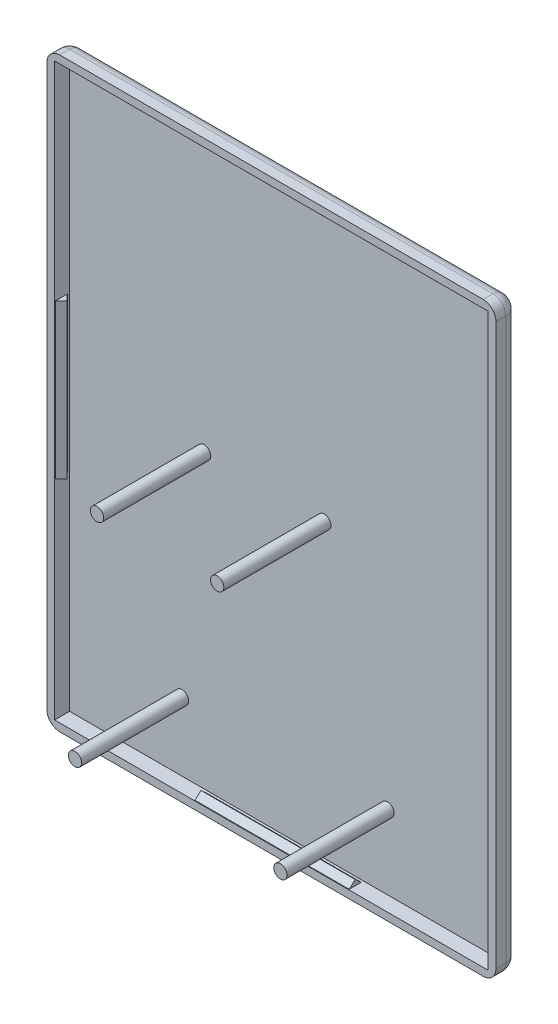
from build123d import *

# Parameters (mm, degrees)
ESQUISSE1_W        = 101.2
ESQUISSE1_H        = 133.2
BOSS_EXTRU_1_DEPTH = 3.5
COQUE1_T           = 1.8
CONG_4_R           = 3
BOSS_EXTRU_2_DEPTH = 18
BOSS_EXTRU_3_DEPTH = 18
ESQUISSE5_R        = 1.55
BOSS_EXTRU_4_DEPTH = 25


with BuildPart() as part:
    # Esquisse1 → Boss.-Extru.1 (new body)
    with BuildSketch(Plane.XY):
        Rectangle(ESQUISSE1_W, ESQUISSE1_H)
    extrude(amount=-BOSS_EXTRU_1_DEPTH)

    # Coque1
    coque1_openings = [part.faces().sort_by_distance(p)[0] for p in [
        (0, 0, 0),
    ]]
    offset(amount=COQUE1_T, openings=coque1_openings, kind=Kind.INTERSECTION)

    # Congé4
    # the kernel refuses this fillet: 3 mm, written as the material it takes off along each edge
    with BuildSketch(Plane(origin=(-49.4, -65.4, -2.3), x_dir=(0, 0, -1), z_dir=(-1, 0, 0))) as cong_4_piece_1_section:
        Polygon((0, 0), (CONG_4_R, 0), (CONG_4_R, CONG_4_R), (0, CONG_4_R), align=None)
    cong_4_piece_1 = extrude(amount=CONG_4_R, mode=Mode.PRIVATE)
    cong_4_piece_1 = cong_4_piece_1 - Plane(origin=(-49.4, -65.4, -2.3), x_dir=(0, 0.7071067811865475, 0.7071067811865475), z_dir=(-1, 0, 0)) * Sphere(CONG_4_R, mode=Mode.PRIVATE)
    add(cong_4_piece_1, mode=Mode.SUBTRACT)
    with BuildSketch(Plane(origin=(-49.4, 65.4, -2.3), x_dir=(-1, 0, 0), z_dir=(0, 1, 0))) as cong_4_piece_2_section:
        Polygon((0, 0), (CONG_4_R, 0), (CONG_4_R, -CONG_4_R), (0, -CONG_4_R), align=None)
    cong_4_piece_2 = extrude(amount=CONG_4_R, mode=Mode.PRIVATE)
    cong_4_piece_2 = cong_4_piece_2 - Plane(origin=(-49.4, 65.4, -2.3), x_dir=(0.7071067811865475, 0, 0.7071067811865475), z_dir=(0, 1, 0)) * Sphere(CONG_4_R, mode=Mode.PRIVATE)
    add(cong_4_piece_2, mode=Mode.SUBTRACT)
    with BuildSketch(Plane(origin=(49.4, -65.4, -2.3), x_dir=(0, -1, 0), z_dir=(0, 0, -1))) as cong_4_piece_3_section:
        Polygon((0, 0), (CONG_4_R, 0), (CONG_4_R, -CONG_4_R), (0, -CONG_4_R), align=None)
    cong_4_piece_3 = extrude(amount=CONG_4_R, mode=Mode.PRIVATE)
    cong_4_piece_3 = cong_4_piece_3 - Plane(origin=(49.4, -65.4, -2.3), x_dir=(-0.7071067811865475, 0.7071067811865475, 0), z_dir=(0, 0, -1)) * Sphere(CONG_4_R, mode=Mode.PRIVATE)
    add(cong_4_piece_3, mode=Mode.SUBTRACT)
    with BuildSketch(Plane(origin=(49.4, 65.4, -2.3), x_dir=(0, 0, -1), z_dir=(0, 1, 0))) as cong_4_piece_4_section:
        Polygon((0, 0), (CONG_4_R, 0), (CONG_4_R, -CONG_4_R), (0, -CONG_4_R), align=None)
    cong_4_piece_4 = extrude(amount=CONG_4_R, mode=Mode.PRIVATE)
    cong_4_piece_4 = cong_4_piece_4 - Plane(origin=(49.4, 65.4, -2.3), x_dir=(-0.7071067811865475, 0, 0.7071067811865475), z_dir=(0, 1, 0)) * Sphere(CONG_4_R, mode=Mode.PRIVATE)
    add(cong_4_piece_4, mode=Mode.SUBTRACT)
    with BuildSketch(Plane(origin=(-52.4, -65.4, -5.3), x_dir=(0, 0, 1), z_dir=(0, 1, 0)), Plane(origin=(52.4, 65.4, -5.3), x_dir=(0, 0, 1), z_dir=(0, -1, 0))) as cong_4_piece_5:
        with BuildLine():
            CenterArc((CONG_4_R, CONG_4_R), CONG_4_R, 180, 90)
            Line((0, CONG_4_R), (0, 0))
            Line((0, 0), (CONG_4_R, 0))
        make_face()
    extrude(amount=130.8, mode=Mode.SUBTRACT)
    with BuildSketch(Plane(origin=(49.4, -68.4, -5.3), x_dir=(0, 0, 1), z_dir=(-1, 0, 0)), Plane(origin=(-49.4, 68.4, -5.3), x_dir=(0, 0, 1), z_dir=(1, 0, 0))) as cong_4_piece_6:
        with BuildLine():
            CenterArc((CONG_4_R, CONG_4_R), CONG_4_R, 180, 90)
            Line((0, CONG_4_R), (0, 0))
            Line((0, 0), (CONG_4_R, 0))
        make_face()
    extrude(amount=98.8, mode=Mode.SUBTRACT)
    with BuildSketch(Plane(origin=(52.4, -68.4, -2.3), x_dir=(-1, 0, 0), z_dir=(0, 0, 1)), Plane(origin=(-52.4, -68.4, 7.5), x_dir=(1, 0, 0), z_dir=(0, 0, -1)), Plane(origin=(-52.4, 68.4, -2.3), x_dir=(1, 0, 0), z_dir=(0, 0, 1)), Plane(origin=(52.4, 68.4, -2.3), x_dir=(0, -1, 0), z_dir=(0, 0, 1))) as cong_4_piece_7:
        with BuildLine():
            CenterArc((CONG_4_R, -CONG_4_R), CONG_4_R, 90, 90)
            Line((0, -CONG_4_R), (0, 0))
            Line((0, 0), (CONG_4_R, 0))
        make_face()
    extrude(amount=9.8, mode=Mode.SUBTRACT)

    # Esquisse3D1 → Boss.-Extru.2 (add, symmetric)
    with BuildSketch(Plane(origin=(50.6, 0, -0.15), x_dir=(0, 0, -1), z_dir=(0, 1, 0))):
        Polygon((0, 0), (2.8, 0), (1.4, 1.284523258), align=None)
    boss_extru_2 = extrude(amount=BOSS_EXTRU_2_DEPTH, both=True)

    # Symétrie1: Boss.-Extru.2 across plane
    add(boss_extru_2.mirror(Plane(origin=(0, 0, 0), x_dir=(0, 0, 1), z_dir=(1, 0, 0))))

    # Esquisse3D2 → Boss.-Extru.3 (add, symmetric)
    with BuildSketch(Plane(origin=(0, 66.6, -0.15), x_dir=(0, 0, -1), z_dir=(-1, 0, 0))):
        Polygon((0, 0), (2.8, 0), (1.4, 1.284523258), align=None)
    boss_extru_3 = extrude(amount=BOSS_EXTRU_3_DEPTH, both=True)

    # Symétrie2: Boss.-Extru.3 across plane
    add(boss_extru_3.mirror(Plane.ZX))

    # Esquisse5 → Boss.-Extru.4 (add)
    with BuildSketch(Plane.XY.offset(-3.5)):
        with Locations(Location((-24.345, -50.63, 0), (0, 0, 180))):
            Circle(ESQUISSE5_R)
        with Locations(Location((23.585, -49.36, 0), (0, 0, 180))):
            Circle(ESQUISSE5_R)
        with Locations(Location((8.835, 1.44, 0), (0, 0, 180))):
            Circle(ESQUISSE5_R)
        with Locations(Location((-19.205, 1.44, 0), (0, 0, 180))):
            Circle(ESQUISSE5_R)
    extrude(amount=BOSS_EXTRU_4_DEPTH)


solid = part.part
